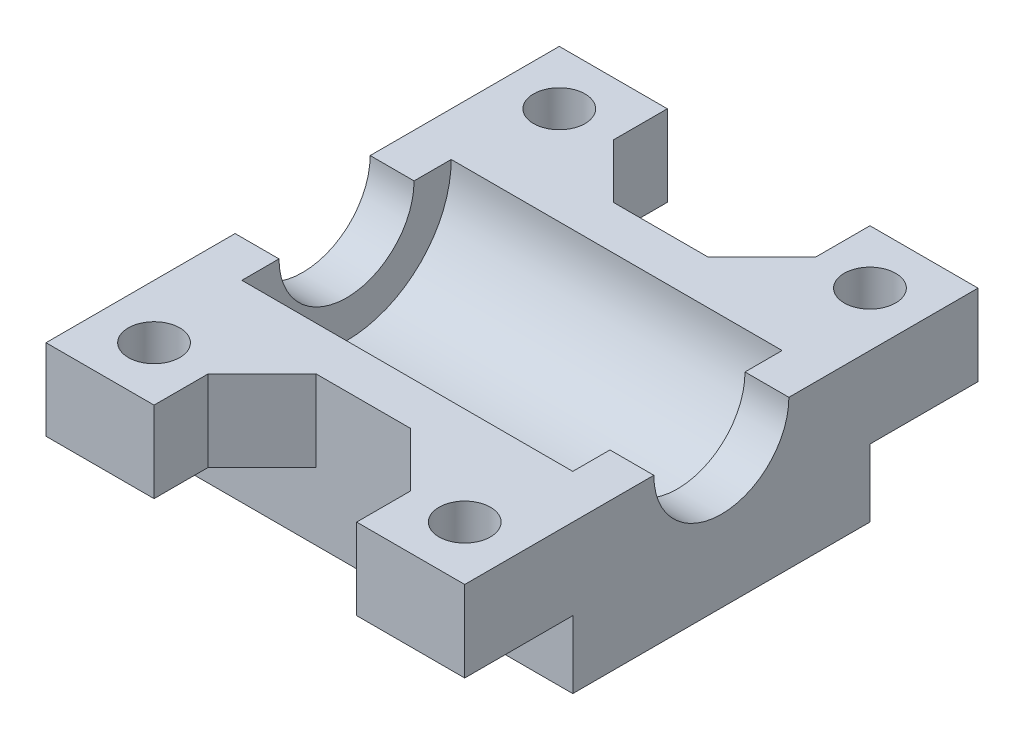
from build123d import *

# Parameters (mm, degrees)
SKETCH1_W                = 31
SKETCH1_H                = 22
BOSS_EXTRUDE1_DEPTH      = 11
SKETCH3_W                = 24.5
SKETCH3_H                = 15.5
CUT_EXTRUDE1_DEPTH       = 7.75
FILLET1_R                = 7.75
CUT_EXTRUDE2_DEPTH       = 32.812929761
CUT_EXTRUDE2_DEPTH_BACK  = 32.812929761
SKETCH4_R                = 5
SKETCH5_W                = 8
SKETCH5_H                = 8
SKETCH5_R                = 1.905800151
BOSS_EXTRUDE3_DEPTH      = 6
MIRROR9_COPY_1_SKETCH_W  = 8
MIRROR9_COPY_1_SKETCH_H  = 8
MIRROR9_COPY_1_SKETCH_R  = 1.905800151
MIRROR9_COPY_1_DEPTH     = 6
CUT_EXTRUDE4_START       = -2
SKETCH7_R                = 1.905800151
CUT_EXTRUDE4_DEPTH       = 2
MIRROR11_START           = -2
MIRROR11_COPY_1_SKETCH_R = 1.905800151
MIRROR11_COPY_1_DEPTH    = 2
CHAMFER3_SIZE            = 4


with BuildPart() as part:
    # Sketch1 → Boss-Extrude1 (new body)
    with BuildSketch(Plane(origin=(0, 0, 0), x_dir=(1, 0, 0), z_dir=(0, 1, 0))):
        Rectangle(SKETCH1_W, SKETCH1_H)
    extrude(amount=BOSS_EXTRUDE1_DEPTH)

    # Sketch3 → Cut-Extrude1 (cut)
    with BuildSketch(Plane(origin=(0, 11, 0), x_dir=(1, 0, 0), z_dir=(0, 1, 0))):
        Rectangle(SKETCH3_W, SKETCH3_H)
    extrude(amount=-CUT_EXTRUDE1_DEPTH, mode=Mode.SUBTRACT)

    # Fillet1
    fillet1_edges = [part.edges().sort_by_distance(p)[0] for p in [
        (0, 3.25, 7.75),
        (0, 3.25, -7.75),
    ]]
    fillet(fillet1_edges, radius=FILLET1_R - 0.0001)  # a hair under: the kernel refuses the full size

    # Sketch4 → Cut-Extrude2 (cut, two sides: drawn at the far end of the back side and taken through both)
    with BuildSketch(Plane(origin=(-12.25, 0, 0), x_dir=(0, 0, -1), z_dir=(1, 0, 0)).offset(-CUT_EXTRUDE2_DEPTH_BACK)):
        with Locations((0, 11)):
            Circle(SKETCH4_R)
    extrude(amount=CUT_EXTRUDE2_DEPTH + CUT_EXTRUDE2_DEPTH_BACK, mode=Mode.SUBTRACT)

    # Sketch5 → Boss-Extrude3 (add)
    with BuildSketch(Plane(origin=(0, 11, 0), x_dir=(1, 0, 0), z_dir=(0, 1, 0))):
        with Locations((11.5, -15)):
            Rectangle(SKETCH5_W, SKETCH5_H)
        with Locations(Location((11.5, -15, 0), (0, 0, 270))):
            Circle(SKETCH5_R, mode=Mode.SUBTRACT)
    boss_extrude3 = extrude(amount=-BOSS_EXTRUDE3_DEPTH)

    # Mirror8: Boss-Extrude3 across plane
    add(boss_extrude3.mirror(Plane(origin=(0, 0, 0), x_dir=(0, 0, 1), z_dir=(1, 0, 0))))

    # Mirror9: Boss-Extrude3 across plane
    add(boss_extrude3.mirror(Plane.XY))

    # Mirror9 copy 1 sketch → Mirror9 copy 1 (add)
    with BuildSketch(Plane(origin=(0, 11, 0), x_dir=(-1, 0, 0), z_dir=(0, 1, 0))):
        with Locations((11.5, -15)):
            Rectangle(MIRROR9_COPY_1_SKETCH_W, MIRROR9_COPY_1_SKETCH_H)
        with Locations(Location((11.5, -15, 0), (0, 0, 270))):
            Circle(MIRROR9_COPY_1_SKETCH_R, mode=Mode.SUBTRACT)
    extrude(amount=-MIRROR9_COPY_1_DEPTH)

    # Sketch7 → Cut-Extrude4 (cut)
    with BuildSketch(Plane.XZ.offset(-5).offset(CUT_EXTRUDE4_START)):
        Polygon((14.675426481, 15), (13.08771324, 17.75), (9.91228676, 17.75), (8.324573519, 15), (9.91228676, 12.25), (13.08771324, 12.25), align=None)
        with Locations(Location((11.5, 15, 0), (0, 0, 90))):
            Circle(SKETCH7_R, mode=Mode.SUBTRACT)
    cut_extrude4 = extrude(amount=CUT_EXTRUDE4_DEPTH, mode=Mode.SUBTRACT)

    # Mirror10: Cut-Extrude4 across plane
    add(cut_extrude4.mirror(Plane(origin=(0, 0, 0), x_dir=(0, 0, 1), z_dir=(1, 0, 0))), mode=Mode.SUBTRACT)

    # Mirror11: Cut-Extrude4 across plane
    add(cut_extrude4.mirror(Plane.XY), mode=Mode.SUBTRACT)

    # Mirror11 copy 1 sketch → Mirror11 copy 1 (cut)
    with BuildSketch(Plane(origin=(0, 5, 0), x_dir=(-1, 0, 0), z_dir=(0, -1, 0)).offset(MIRROR11_START)):
        Polygon((14.675426481, 15), (13.08771324, 17.75), (9.91228676, 17.75), (8.324573519, 15), (9.91228676, 12.25), (13.08771324, 12.25), align=None)
        with Locations(Location((11.5, 15, 0), (0, 0, 90))):
            Circle(MIRROR11_COPY_1_SKETCH_R, mode=Mode.SUBTRACT)
    extrude(amount=MIRROR11_COPY_1_DEPTH, mode=Mode.SUBTRACT)

    # Chamfer3
    chamfer3_edges = [part.edges().sort_by_distance(p)[0] for p in [
        (7.5, 8, 11),
        (-7.5, 8, 11),
        (-7.5, 8, -11),
        (7.5, 8, -11),
    ]]
    chamfer(chamfer3_edges, length=CHAMFER3_SIZE)


solid = part.part
